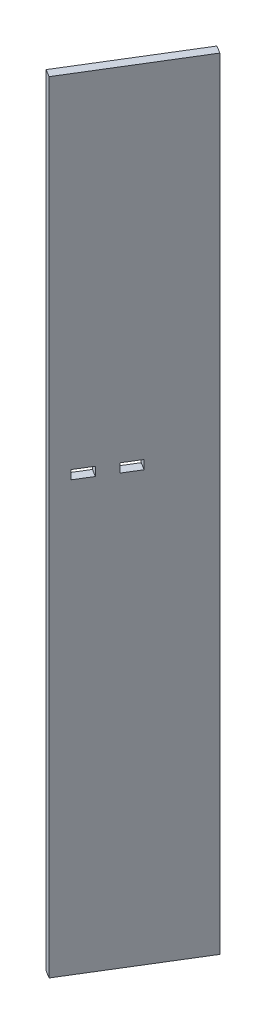
from build123d import *

# Parameters (mm, degrees)
SKETCH2_W           = 6.35
SKETCH2_H           = 88.9
BOSS_EXTRUDE1_DEPTH = 558.8
SKETCH3_W           = 12.7
SKETCH3_H           = 6.35
CUT_EXTRUDE1_DEPTH  = 563.153290951


with BuildPart() as part:
    # Sketch2 → Boss-Extrude1 (new body)
    with BuildSketch(Plane(origin=(-119.898718407, 0, -90.007594481), x_dir=(-0.8523151338955438, 0, -0.5230285962857302), z_dir=(0, 1, 0))):
        with Locations((-41.275, 0)):
            Rectangle(SKETCH2_W, SKETCH2_H)
    extrude(amount=BOSS_EXTRUDE1_DEPTH)

    # Sketch3 → Cut-Extrude1 (cut, through all)
    with BuildSketch(Plane(origin=(-89.338000118, 0, -54.822831296), x_dir=(0.5230285962857302, -1.4972728240262083e-15, -0.8523151338955438), z_dir=(0.8523151338955437, 0, 0.5230285962857301))):
        with Locations((-12.7, 310.13)):
            Rectangle(SKETCH3_W, SKETCH3_H)
        with Locations((12.7, 310.13)):
            Rectangle(SKETCH3_W, SKETCH3_H)
    extrude(amount=-CUT_EXTRUDE1_DEPTH, mode=Mode.SUBTRACT)


solid = part.part
